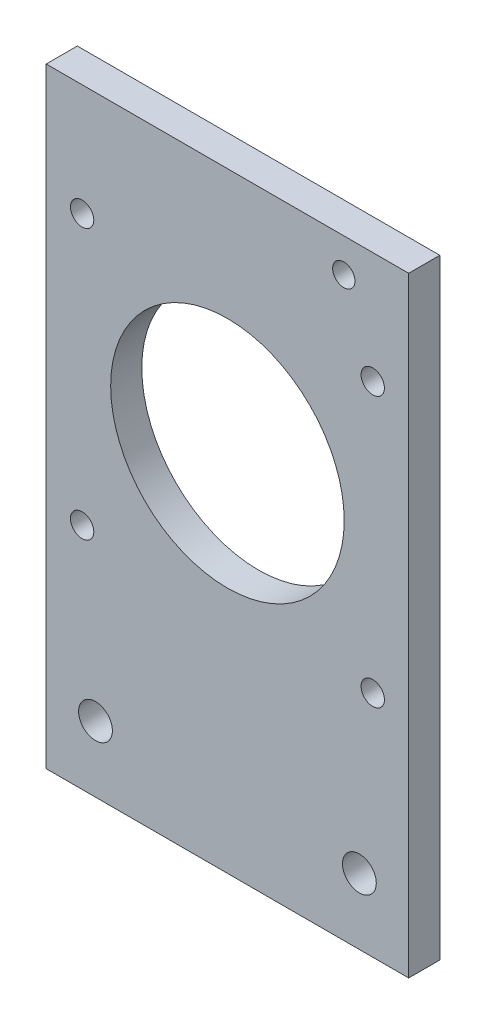
from build123d import *

# Parameters (mm, degrees)
SKETCH2_R           = 22.5
BOSS_EXTRUDE1_DEPTH = 3
SKETCH3_R           = 3.25755
SKETCH3_R_2         = 2.15
CUT_EXTRUDE1_DEPTH  = 6
SKETCH4_R           = 2.25
CUT_EXTRUDE2_DEPTH  = 10


with BuildPart() as part:
    # Sketch2 → Boss-Extrude1 (new, symmetric)
    with BuildSketch(Plane.XY):
        Polygon((-34.925, 0), (34.925, 0), (34.925, 70.1), (34.925, 102.6), (34.925, 117.6), (-34.925, 117.6), (-34.925, 102.6), (-34.925, 70.1), align=None)
        with Locations((0, 70.1)):
            Circle(SKETCH2_R, mode=Mode.SUBTRACT)
    extrude(amount=BOSS_EXTRUDE1_DEPTH, both=True)

    # Sketch3 → Cut-Extrude1 (cut)
    with BuildSketch(Plane.XY.offset(3)):
        with Locations((-25.425, 12.7)):
            Circle(SKETCH3_R)
        with Locations((25.425, 12.7)):
            Circle(SKETCH3_R)
        with Locations((22.425, 111.1)):
            Circle(SKETCH3_R_2)
    extrude(amount=-CUT_EXTRUDE1_DEPTH, mode=Mode.SUBTRACT)

    # Sketch4 → Cut-Extrude2 (cut)
    with BuildSketch(Plane.XY.offset(3)):
        with Locations((28, 96.1)):
            Circle(SKETCH4_R)
        with Locations((-28, 44.1)):
            Circle(SKETCH4_R)
        with Locations((28, 44.1)):
            Circle(SKETCH4_R)
        with Locations((-28, 96.1)):
            Circle(SKETCH4_R)
    extrude(amount=-CUT_EXTRUDE2_DEPTH, mode=Mode.SUBTRACT)


solid = part.part
